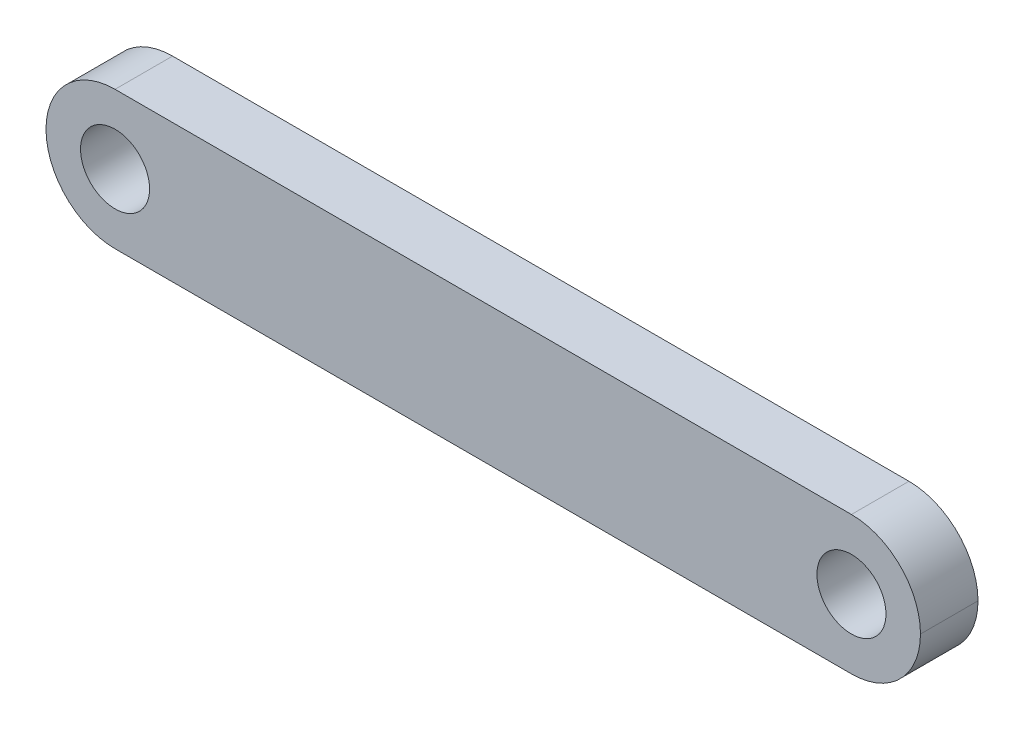
from build123d import *

# Parameters (mm, degrees)
SKIZZE1_W                       = 76
SKIZZE1_H                       = 12
AUFSATZ_LINEAR_AUSTRAGEN1_DEPTH = 5
VERRUNDUNG1_R                   = 6
F_6_0_6_DURCHMESSER_BOHRUNG3_D  = 6


with BuildPart() as part:
    # Skizze1 → Aufsatz-Linear austragen1 (new body)
    with BuildSketch(Plane.XY):
        Rectangle(SKIZZE1_W, SKIZZE1_H)
    extrude(amount=AUFSATZ_LINEAR_AUSTRAGEN1_DEPTH)

    # Verrundung1
    verrundung1_edges = [part.edges().sort_by_distance(p)[0] for p in [
        (-38, -6, 2.5),
        (38, -6, 2.5),
        (38, 6, 2.5),
        (-38, 6, 2.5),
    ]]
    fillet(verrundung1_edges, radius=VERRUNDUNG1_R - 0.0001)  # a hair under: the kernel refuses the full size

    # Ø6.0 (6) Durchmesser Bohrung3 (through all)
    with Locations(Plane.XY.offset(5)):
        with Locations((-32, 0), (32, 0)):
            Hole(F_6_0_6_DURCHMESSER_BOHRUNG3_D / 2)


solid = part.part
